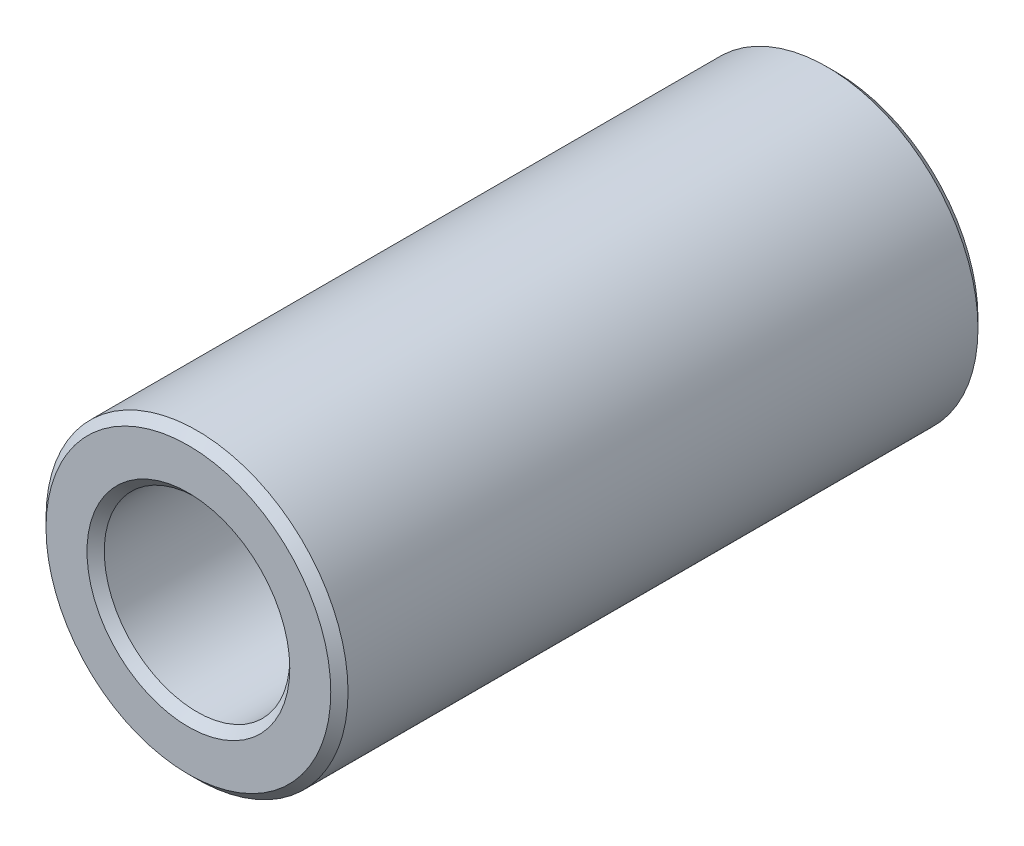
from build123d import *

# Parameters (mm, degrees)
SKETCH_1_R      = 3.5
SKETCH_1_R_2    = 2.15
EXTRUDE_1_DEPTH = 15
CHAMFER_1_SIZE  = 0.2


with BuildPart() as part:
    # Эскиз1 → Бобышка-Вытянуть1 (new body)
    with BuildSketch(Plane.XY):
        Circle(SKETCH_1_R)
        Circle(SKETCH_1_R_2, mode=Mode.SUBTRACT)
    extrude(amount=EXTRUDE_1_DEPTH)

    # Фаска1
    chamfer_1_edges = [part.edges().sort_by_distance(p)[0] for p in [
        (-2.15, 0, 0),
        (-3.5, 0, 0),
        (-2.15, 0, 15),
        (-3.5, 0, 15),
    ]]
    chamfer(chamfer_1_edges, length=CHAMFER_1_SIZE)


solid = part.part
